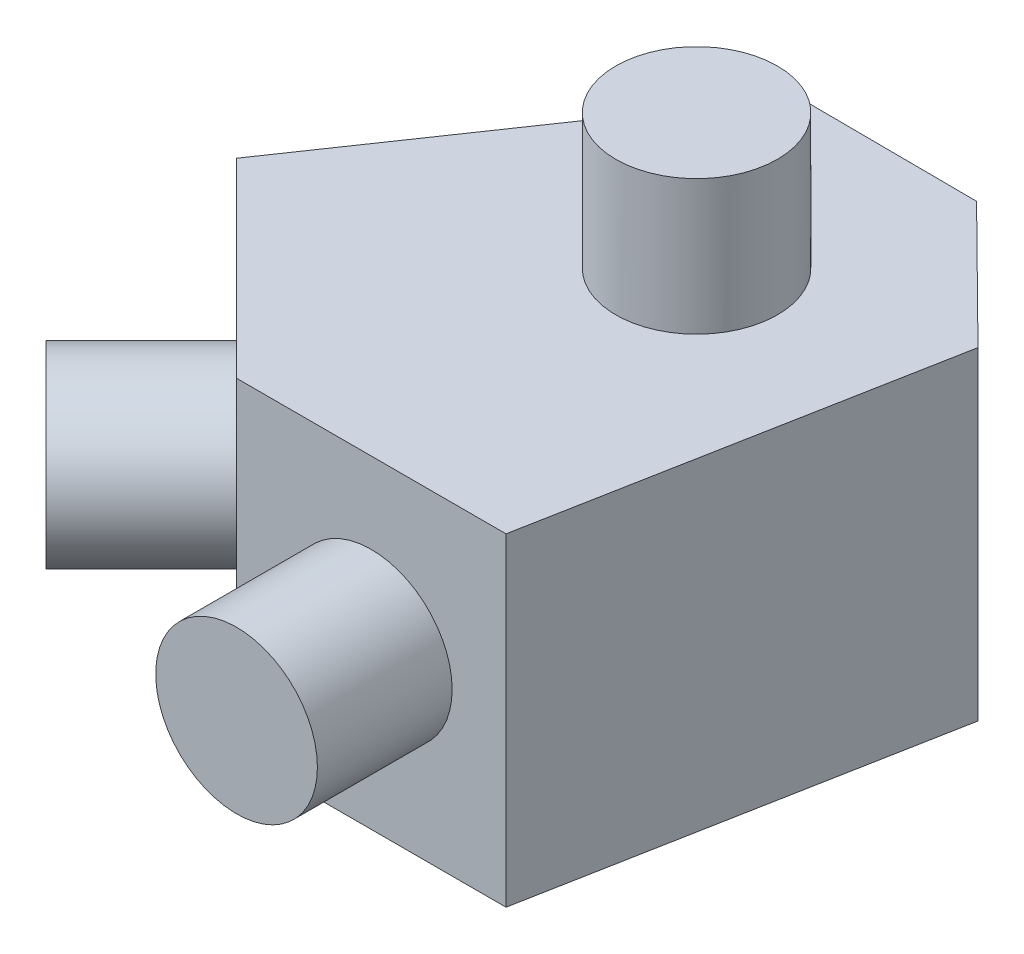
from build123d import *

# Parameters (mm, degrees)
BOSS_EXTRUDE1_DEPTH = 15.24
SKETCH2_R           = 3.81
BOSS_EXTRUDE2_DEPTH = 6.35
SKETCH5_R           = 3.81
BOSS_EXTRUDE3_DEPTH = 6.35


with BuildPart() as part:
    # Sketch1 → Boss-Extrude1 (new body)
    with BuildSketch(Plane(origin=(0, 0, 0), x_dir=(1, 0, 0), z_dir=(0, 1, 0))):
        Polygon((-8.980256121, 8.980256121), (0, 0), (12.7, 0), (16.220075072, 18.721954265), (10.214331376, 24.659577338), (1.769095743, 24.707745892), align=None)
    extrude(amount=BOSS_EXTRUDE1_DEPTH)

    # Sketch2 → Boss-Extrude2 (add)
    with BuildSketch(Plane.XY):
        with Locations((6.35, 7.62)):
            Circle(SKETCH2_R)
    boss_extrude2 = extrude(amount=BOSS_EXTRUDE2_DEPTH)

    # Mirror1: Boss-Extrude2 across plane
    add(boss_extrude2.mirror(Plane(origin=(0, 0, 0), x_dir=(-0.3826834323650866, 0, 0.9238795325112882), z_dir=(0.9238795325112881, 0, 0.38268343236508656))))

    # Sketch5 → Boss-Extrude3 (add)
    with BuildSketch(Plane(origin=(0, 15.24, 0), x_dir=(1, 0, 0), z_dir=(0, 1, 0))):
        with Locations((6.35, 15.330256121)):
            Circle(SKETCH5_R)
    extrude(amount=BOSS_EXTRUDE3_DEPTH)


solid = part.part
